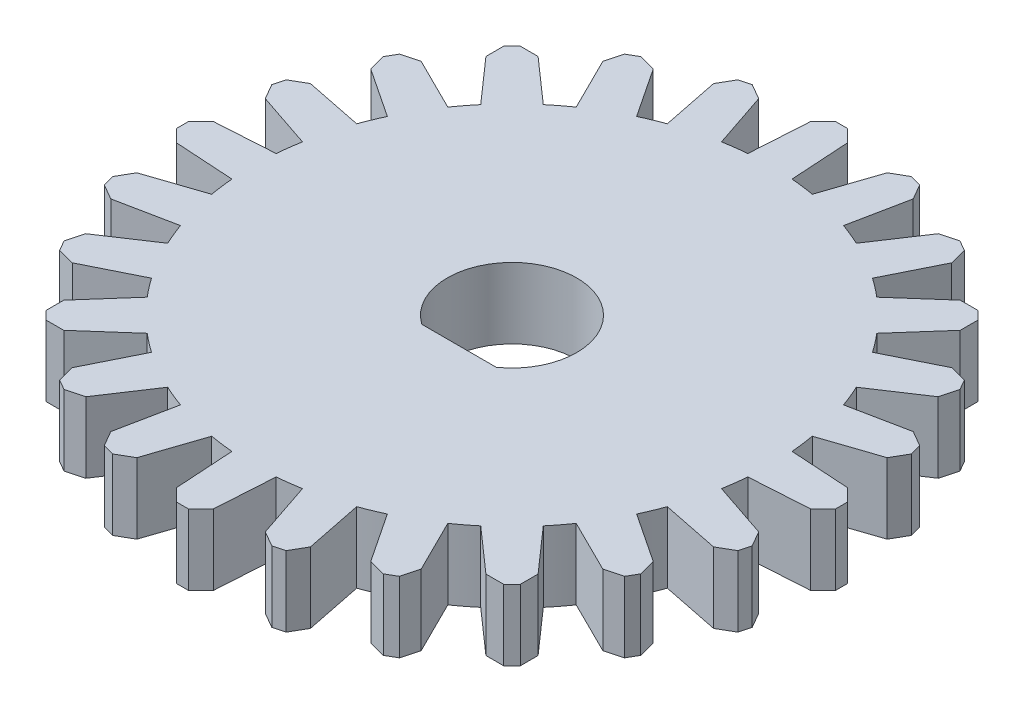
from build123d import *

# Parameters (mm, degrees)
SKETCH1_R             = 11
BOSS_EXTRUDE1_DEPTH   = 3
CUT_EXTRUDE1_DEPTH    = 3
BOSS_EXTRUDE2_DEPTH   = 3
CHAMFER1_SIZE         = 0.5
CHAMFER1_SIZE2        = 0.534373985
CHAMFER1_EDGE_2_SIZE  = 0.5
CHAMFER1_EDGE_2_SIZE2 = 0.534373985
CIRPATTERN2_DEPTH     = 3


# Read off the part's stored shape, not the designer's step: CirPattern2
with BuildPart() as part:
    # Sketch1 → Boss-Extrude1 (new body)
    with BuildSketch(Plane(origin=(0, 0, 0), x_dir=(1, 0, 0), z_dir=(0, 1, 0))):
        with Locations(Location((0, 0, 0), (0, 0, 270))):
            Circle(SKETCH1_R)
    extrude(amount=BOSS_EXTRUDE1_DEPTH)

    # Sketch3 → Cut-Extrude1 (cut)
    with BuildSketch(Plane(origin=(0, 3, 0), x_dir=(1, 0, 0), z_dir=(0, 1, 0))):
        with BuildLine():
            Line((-1.58113883, -2.25), (1.58113883, -2.25))
            ThreePointArc((1.58113883, -2.25), (0, 2.75), (-1.58113883, -2.25))
        make_face()
    extrude(amount=-CUT_EXTRUDE1_DEPTH, mode=Mode.SUBTRACT)

    # Sketch2 → Boss-Extrude2 (add)
    with BuildSketch(Plane(origin=(0, 3, 0), x_dir=(1, 0, 0), z_dir=(0, 1, 0))):
        Polygon((1, 10), (-1, 10), (-0.75, 14), (0.75, 14), align=None)
    extrude(amount=-BOSS_EXTRUDE2_DEPTH)

    # Chamfer1
    chamfer1_edges = [part.edges().sort_by_distance(p)[0] for p in [
        (0.75, 1.5, -14),
    ]]
    chamfer1_side = [part.faces().sort_by_distance(p)[0] for p in [
        (0, 1.5, -14),
    ]]
    chamfer(chamfer1_edges, length=CHAMFER1_SIZE, length2=CHAMFER1_SIZE2, reference=chamfer1_side[0])

    # Chamfer1 edge 2
    chamfer1_edge_2_edges = [part.edges().sort_by_distance(p)[0] for p in [
        (-0.75, 1.5, -14),
    ]]
    chamfer1_edge_2_side = [part.faces().sort_by_distance(p)[0] for p in [
        (0, 1.5, -14),
    ]]
    chamfer(chamfer1_edge_2_edges, length=CHAMFER1_EDGE_2_SIZE, length2=CHAMFER1_EDGE_2_SIZE2, reference=chamfer1_edge_2_side[0])

    # CirPattern2 outline → CirPattern2 (add)
    with BuildSketch(Plane(origin=(0, 0, 0), x_dir=(1, 0, 0), z_dir=(0, 1, 0))):
        with BuildLine():
            Line((-4.242071705, 12.805059542), (-3.74457968, 10.343022915))
            ThreePointArc((-3.74457968, 10.343022915), (-2.847009497, 10.625184089), (-1.928610329, 10.829610437))
            Line((-1.928610329, 10.829610437), (-2.72878791, 13.210542713))
            Line((-2.72878791, 13.210542713), (-3.381985175, 13.587666329))
            Line((-3.381985175, 13.587666329), (-3.864948088, 13.458256807))
            Line((-3.864948088, 13.458256807), (-4.242071705, 12.805059542))
        make_face()
        with BuildLine():
            Line((-7.4117199, 11.270808771), (-6.293957535, 9.021424419))
            ThreePointArc((-6.293957535, 9.021424419), (-5.5, 9.526279442), (-4.665803957, 9.961439326))
            Line((-4.665803957, 9.961439326), (-6.054946767, 12.054142104))
            Line((-6.054946767, 12.054142104), (-6.783493649, 12.249355653))
            Line((-6.783493649, 12.249355653), (-7.216506351, 11.999355653))
            Line((-7.216506351, 11.999355653), (-7.4117199, 11.270808771))
        make_face()
        with BuildLine():
            Line((-10.076271632, 8.968471008), (-8.414412587, 7.085030757))
            ThreePointArc((-8.414412587, 7.085030757), (-7.778174593, 7.778174593), (-7.085030757, 8.414412587))
            Line((-7.085030757, 8.414412587), (-8.968471008, 10.076271632))
            Line((-8.968471008, 10.076271632), (-9.722718241, 10.076271632))
            Line((-9.722718241, 10.076271632), (-10.076271632, 9.722718241))
            Line((-10.076271632, 9.722718241), (-10.076271632, 8.968471008))
        make_face()
        with BuildLine():
            Line((-12.054142104, 6.054946767), (-9.961439326, 4.665803957))
            ThreePointArc((-9.961439326, 4.665803957), (-9.526279442, 5.5), (-9.021424419, 6.293957535))
            Line((-9.021424419, 6.293957535), (-11.270808771, 7.4117199))
            Line((-11.270808771, 7.4117199), (-11.999355653, 7.216506351))
            Line((-11.999355653, 7.216506351), (-12.249355653, 6.783493649))
            Line((-12.249355653, 6.783493649), (-12.054142104, 6.054946767))
        make_face()
        with BuildLine():
            Line((-13.210542713, 2.72878791), (-10.829610436, 1.928610329))
            ThreePointArc((-10.829610436, 1.928610329), (-10.625184089, 2.847009497), (-10.343022915, 3.74457968))
            Line((-10.343022915, 3.74457968), (-12.805059542, 4.242071705))
            Line((-12.805059542, 4.242071705), (-13.458256807, 3.864948088))
            Line((-13.458256807, 3.864948088), (-13.587666329, 3.381985175))
            Line((-13.587666329, 3.381985175), (-13.210542713, 2.72878791))
        make_face()
        with BuildLine():
            ThreePointArc((1.928610329, 10.829610437), (2.847009497, 10.625184089), (3.74457968, 10.343022915))
            Line((3.74457968, 10.343022915), (4.242071705, 12.805059542))
            Line((4.242071705, 12.805059542), (3.864948088, 13.458256807))
            Line((3.864948088, 13.458256807), (3.381985175, 13.587666329))
            Line((3.381985175, 13.587666329), (2.72878791, 13.210542713))
            Line((2.72878791, 13.210542713), (1.928610329, 10.829610437))
        make_face()
        with BuildLine():
            ThreePointArc((4.665803957, 9.961439326), (5.5, 9.526279442), (6.293957535, 9.021424419))
            Line((6.293957535, 9.021424419), (7.4117199, 11.270808771))
            Line((7.4117199, 11.270808771), (7.216506351, 11.999355653))
            Line((7.216506351, 11.999355653), (6.783493649, 12.249355653))
            Line((6.783493649, 12.249355653), (6.054946767, 12.054142104))
            Line((6.054946767, 12.054142104), (4.665803957, 9.961439326))
        make_face()
        with BuildLine():
            ThreePointArc((7.085030757, 8.414412587), (7.778174593, 7.778174593), (8.414412587, 7.085030757))
            Line((8.414412587, 7.085030757), (10.076271632, 8.968471008))
            Line((10.076271632, 8.968471008), (10.076271632, 9.722718241))
            Line((10.076271632, 9.722718241), (9.722718241, 10.076271632))
            Line((9.722718241, 10.076271632), (8.968471008, 10.076271632))
            Line((8.968471008, 10.076271632), (7.085030757, 8.414412587))
        make_face()
        with BuildLine():
            ThreePointArc((9.021424419, 6.293957535), (9.526279442, 5.5), (9.961439326, 4.665803957))
            Line((9.961439326, 4.665803957), (12.054142104, 6.054946767))
            Line((12.054142104, 6.054946767), (12.249355653, 6.783493649))
            Line((12.249355653, 6.783493649), (11.999355653, 7.216506351))
            Line((11.999355653, 7.216506351), (11.270808771, 7.4117199))
            Line((11.270808771, 7.4117199), (9.021424419, 6.293957535))
        make_face()
        with BuildLine():
            ThreePointArc((10.343022915, 3.74457968), (10.625184089, 2.847009497), (10.829610436, 1.928610329))
            Line((10.829610436, 1.928610329), (13.210542713, 2.72878791))
            Line((13.210542713, 2.72878791), (13.587666329, 3.381985175))
            Line((13.587666329, 3.381985175), (13.458256807, 3.864948088))
            Line((13.458256807, 3.864948088), (12.805059542, 4.242071705))
            Line((12.805059542, 4.242071705), (10.343022915, 3.74457968))
        make_face()
        with BuildLine():
            ThreePointArc((10.959761493, 0.940014907), (11, 0), (10.959761493, -0.940014907))
            Line((10.959761493, -0.940014907), (13.466666667, -0.783333333))
            Line((13.466666667, -0.783333333), (14, -0.25))
            Line((14, -0.25), (14, 0.25))
            Line((14, 0.25), (13.466666667, 0.783333333))
            Line((13.466666667, 0.783333333), (10.959761493, 0.940014907))
        make_face()
        with BuildLine():
            ThreePointArc((10.829610436, -1.928610329), (10.625184089, -2.847009497), (10.343022915, -3.74457968))
            Line((10.343022915, -3.74457968), (12.805059542, -4.242071705))
            Line((12.805059542, -4.242071705), (13.458256807, -3.864948088))
            Line((13.458256807, -3.864948088), (13.587666329, -3.381985175))
            Line((13.587666329, -3.381985175), (13.210542713, -2.72878791))
            Line((13.210542713, -2.72878791), (10.829610436, -1.928610329))
        make_face()
        with BuildLine():
            ThreePointArc((9.961439325, -4.665803957), (9.526279442, -5.5), (9.021424419, -6.293957535))
            Line((9.021424419, -6.293957535), (11.270808771, -7.4117199))
            Line((11.270808771, -7.4117199), (11.999355653, -7.216506351))
            Line((11.999355653, -7.216506351), (12.249355653, -6.783493649))
            Line((12.249355653, -6.783493649), (12.054142104, -6.054946767))
            Line((12.054142104, -6.054946767), (9.961439325, -4.665803957))
        make_face()
        with BuildLine():
            ThreePointArc((8.414412587, -7.085030757), (7.778174593, -7.778174593), (7.085030757, -8.414412587))
            Line((7.085030757, -8.414412587), (8.968471008, -10.076271632))
            Line((8.968471008, -10.076271632), (9.722718241, -10.076271632))
            Line((9.722718241, -10.076271632), (10.076271632, -9.722718241))
            Line((10.076271632, -9.722718241), (10.076271632, -8.968471008))
            Line((10.076271632, -8.968471008), (8.414412587, -7.085030757))
        make_face()
        with BuildLine():
            ThreePointArc((6.293957535, -9.021424419), (5.5, -9.526279442), (4.665803957, -9.961439325))
            Line((4.665803957, -9.961439325), (6.054946767, -12.054142104))
            Line((6.054946767, -12.054142104), (6.783493649, -12.249355653))
            Line((6.783493649, -12.249355653), (7.216506351, -11.999355653))
            Line((7.216506351, -11.999355653), (7.4117199, -11.270808771))
            Line((7.4117199, -11.270808771), (6.293957535, -9.021424419))
        make_face()
        with BuildLine():
            ThreePointArc((3.74457968, -10.343022915), (2.847009497, -10.625184089), (1.928610329, -10.829610436))
            Line((1.928610329, -10.829610436), (2.72878791, -13.210542713))
            Line((2.72878791, -13.210542713), (3.381985175, -13.587666329))
            Line((3.381985175, -13.587666329), (3.864948088, -13.458256807))
            Line((3.864948088, -13.458256807), (4.242071705, -12.805059542))
            Line((4.242071705, -12.805059542), (3.74457968, -10.343022915))
        make_face()
        with BuildLine():
            ThreePointArc((0.940014907, -10.959761493), (0, -11), (-0.940014907, -10.959761493))
            Line((-0.940014907, -10.959761493), (-0.783333333, -13.466666667))
            Line((-0.783333333, -13.466666667), (-0.25, -14))
            Line((-0.25, -14), (0.25, -14))
            Line((0.25, -14), (0.783333333, -13.466666667))
            Line((0.783333333, -13.466666667), (0.940014907, -10.959761493))
        make_face()
        with BuildLine():
            ThreePointArc((-1.928610329, -10.829610436), (-2.847009497, -10.625184089), (-3.74457968, -10.343022915))
            Line((-3.74457968, -10.343022915), (-4.242071705, -12.805059542))
            Line((-4.242071705, -12.805059542), (-3.864948088, -13.458256807))
            Line((-3.864948088, -13.458256807), (-3.381985175, -13.587666329))
            Line((-3.381985175, -13.587666329), (-2.72878791, -13.210542713))
            Line((-2.72878791, -13.210542713), (-1.928610329, -10.829610436))
        make_face()
        with BuildLine():
            ThreePointArc((-4.665803957, -9.961439325), (-5.5, -9.526279442), (-6.293957535, -9.021424419))
            Line((-6.293957535, -9.021424419), (-7.4117199, -11.270808771))
            Line((-7.4117199, -11.270808771), (-7.216506351, -11.999355653))
            Line((-7.216506351, -11.999355653), (-6.783493649, -12.249355653))
            Line((-6.783493649, -12.249355653), (-6.054946767, -12.054142104))
            Line((-6.054946767, -12.054142104), (-4.665803957, -9.961439325))
        make_face()
        with BuildLine():
            ThreePointArc((-7.085030757, -8.414412587), (-7.778174593, -7.778174593), (-8.414412587, -7.085030757))
            Line((-8.414412587, -7.085030757), (-10.076271632, -8.968471008))
            Line((-10.076271632, -8.968471008), (-10.076271632, -9.722718241))
            Line((-10.076271632, -9.722718241), (-9.722718241, -10.076271632))
            Line((-9.722718241, -10.076271632), (-8.968471008, -10.076271632))
            Line((-8.968471008, -10.076271632), (-7.085030757, -8.414412587))
        make_face()
        with BuildLine():
            ThreePointArc((-9.021424419, -6.293957535), (-9.526279442, -5.5), (-9.961439325, -4.665803957))
            Line((-9.961439325, -4.665803957), (-12.054142104, -6.054946767))
            Line((-12.054142104, -6.054946767), (-12.249355653, -6.783493649))
            Line((-12.249355653, -6.783493649), (-11.999355653, -7.216506351))
            Line((-11.999355653, -7.216506351), (-11.270808771, -7.4117199))
            Line((-11.270808771, -7.4117199), (-9.021424419, -6.293957535))
        make_face()
        with BuildLine():
            ThreePointArc((-10.343022915, -3.74457968), (-10.625184089, -2.847009497), (-10.829610436, -1.928610329))
            Line((-10.829610436, -1.928610329), (-13.210542713, -2.72878791))
            Line((-13.210542713, -2.72878791), (-13.587666329, -3.381985175))
            Line((-13.587666329, -3.381985175), (-13.458256807, -3.864948088))
            Line((-13.458256807, -3.864948088), (-12.805059542, -4.242071705))
            Line((-12.805059542, -4.242071705), (-10.343022915, -3.74457968))
        make_face()
        with BuildLine():
            Line((-13.466666667, 0.783333333), (-14, 0.25))
            Line((-14, 0.25), (-14, -0.25))
            Line((-14, -0.25), (-13.466666667, -0.783333333))
            Line((-13.466666667, -0.783333333), (-10.959761493, -0.940014907))
            ThreePointArc((-10.959761493, -0.940014907), (-11, 0), (-10.959761493, 0.940014907))
            Line((-10.959761493, 0.940014907), (-13.466666667, 0.783333333))
        make_face()
    extrude(amount=CIRPATTERN2_DEPTH)


solid = part.part
